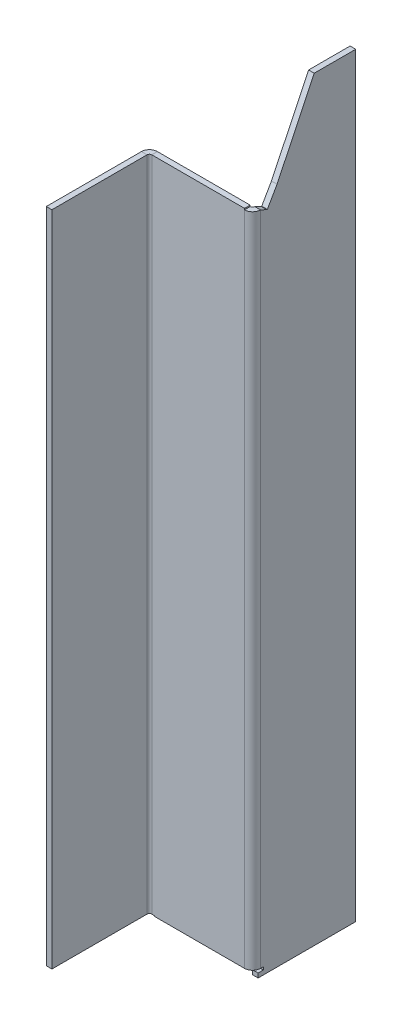
from build123d import *

# Parameters (mm, degrees)
BASE_FLANGE1_DEPTH            = 1.7366
EDGE_FLANGE1_START            = -115.730831119
EDGE_FLANGE1_DEPTH            = 204.671095583
EDGE_FLANGE1_2_DEPTH          = 0.8683
EDGE_FLANGE1_START_2          = 88.594139894
EDGE_FLANGE1_3_DEPTH          = 0.34612457
EDGE_FLANGE1_START_3          = -114.862531119
EDGE_FLANGE1_4_DEPTH          = 203.456671013
EDGE_FLANGE1_5_OUTLINE_W      = 29.4634
EDGE_FLANGE1_5_OUTLINE_H      = 1.7366
EDGE_FLANGE1_5_DEPTH          = 0.405860106
EDGE_FLANGE2_STRIP_W          = 8.4196
EDGE_FLANGE2_STRIP_H          = 1.7366
EDGE_FLANGE2_STRIP_CUT_DEPTH  = 203.662531119
EDGE_FLANGE2_RELIEF_W         = 9.2879
EDGE_FLANGE2_RELIEF_H         = 0.8683
EDGE_FLANGE2_RELIEF_CUT_DEPTH = 1.7366
EDGE_FLANGE2_DEPTH            = 203.662531119


# Read off the part's stored shape, not the designer's step: Edge-Flange1
# Sheet-metal steps are written as plain solids
with BuildPart() as part:
    # Sketch1 → Base-Flange1 (new body)
    with BuildSketch(Plane(origin=(0, 0, 0), x_dir=(0, 0, -1), z_dir=(1, 0, 0))):
        Polygon((2.253419205, 116.937468881), (-9.259888049, 92.904226435), (-12.275167803, 87.656070952), (-12.429418016, 87.67778326), (-15.116149142, 88.940264464), (-15.116149142, -117.062531119), (15.1, -117.062531119), (15.1, 116.937468881), align=None)
    extrude(amount=-BASE_FLANGE1_DEPTH)

    # Edge-Flange1 outline → Edge-Flange1 (cut)
    with BuildSketch(Plane(origin=(0, 0, 0), x_dir=(1, 0, 0), z_dir=(0, 1, 0)).offset(EDGE_FLANGE1_START)):
        with BuildLine():
            Line((0, -15.116149142), (0, -14.379549142))
            ThreePointArc((0, -14.379549142), (-0.02822066, -14.752100167), (-0.112238611, -15.116149142))
            Line((-0.112238611, -15.116149142), (0, -15.116149142))
        make_face()
    extrude(amount=EDGE_FLANGE1_DEPTH, mode=Mode.SUBTRACT)

    # Edge-Flange1 2 outline → Edge-Flange1 2 (cut)
    with BuildSketch(Plane(origin=(0, 0, 0), x_dir=(1, 0, 0), z_dir=(0, 1, 0)).offset(EDGE_FLANGE1_START)):
        with BuildLine():
            Line((0, -13.511249142), (-1.7366, -13.511249142))
            Line((-1.7366, -13.511249142), (-1.7366, -15.116149142))
            Line((-1.7366, -15.116149142), (-0.112238611, -15.116149142))
            ThreePointArc((-0.112238611, -15.116149142), (-0.02822066, -14.752100167), (0, -14.379549142))
            Line((0, -14.379549142), (0, -13.511249142))
        make_face()
    extrude(amount=EDGE_FLANGE1_2_DEPTH, mode=Mode.SUBTRACT)

    # Edge-Flange1 3 outline → Edge-Flange1 3 (cut)
    with BuildSketch(Plane(origin=(0, 0, 0), x_dir=(1, 0, 0), z_dir=(0, 1, 0)).offset(EDGE_FLANGE1_START_2)):
        with BuildLine():
            Line((0, -13.511249142), (-1.7366, -13.511249142))
            Line((-1.7366, -13.511249142), (-1.7366, -15.116149142))
            Line((-1.7366, -15.116149142), (-0.112238611, -15.116149142))
            ThreePointArc((-0.112238611, -15.116149142), (-0.02822066, -14.752100167), (0, -14.379549142))
            Line((0, -14.379549142), (0, -13.511249142))
        make_face()
    extrude(amount=EDGE_FLANGE1_3_DEPTH, mode=Mode.SUBTRACT)

    # Edge-Flange1 4 outline → Edge-Flange1 4 (add)
    with BuildSketch(Plane(origin=(0, 0, 0), x_dir=(1, 0, 0), z_dir=(0, 1, 0)).offset(EDGE_FLANGE1_START_3)):
        with BuildLine():
            Line((-1.7366, -15.116149142), (-1.7366, -14.379549142))
            ThreePointArc((-1.7366, -14.379549142), (-1.952345145, -14.900403997), (-2.4732, -15.116149142))
            Line((-2.4732, -15.116149142), (-31.9366, -15.116149142))
            Line((-31.9366, -15.116149142), (-31.9366, -16.852749142))
            Line((-31.9366, -16.852749142), (-2.4732, -16.852749142))
            ThreePointArc((-2.4732, -16.852749142), (-1.007771885, -16.371843969), (-0.112238611, -15.116149142))
            Line((-0.112238611, -15.116149142), (-1.7366, -15.116149142))
        make_face()
    extrude(amount=EDGE_FLANGE1_4_DEPTH)

    # Edge-Flange1 5 outline → Edge-Flange1 5 (add)
    with BuildSketch(Plane(origin=(0, 0, 0), x_dir=(1, 0, 0), z_dir=(0, 1, 0)).offset(EDGE_FLANGE1_START_2)):
        with Locations((-17.2049, -15.984449142)):
            Rectangle(EDGE_FLANGE1_5_OUTLINE_W, EDGE_FLANGE1_5_OUTLINE_H)
    extrude(amount=EDGE_FLANGE1_5_DEPTH)

    # Edge-Flange2 strip (across the edge) → Edge-Flange2 strip cut (cut)
    with BuildSketch(Plane(origin=(-31.9366, 89, 16.852749142), x_dir=(1, 0, 0), z_dir=(0, -1, 0))):
        with Locations((-3.4732, -0.8683)):
            Rectangle(EDGE_FLANGE2_STRIP_W, EDGE_FLANGE2_STRIP_H)
    extrude(amount=EDGE_FLANGE2_STRIP_CUT_DEPTH, mode=Mode.SUBTRACT)

    # Edge-Flange2 relief (on the sheet) → Edge-Flange2 relief cut (cut)
    with BuildSketch(Plane(origin=(-31.2, 89, 16.852749142), x_dir=(1, 0, 0), z_dir=(0, 0, 1))):
        with Locations((-3.77565, -204.096681119)):
            Rectangle(EDGE_FLANGE2_RELIEF_W, EDGE_FLANGE2_RELIEF_H)
    extrude(amount=-EDGE_FLANGE2_RELIEF_CUT_DEPTH, mode=Mode.SUBTRACT)

    # Edge-Flange2 section (across the edge) → Edge-Flange2 (add)
    with BuildSketch(Plane(origin=(-31.9366, 89, 16.852749142), x_dir=(1, 0, 0), z_dir=(0, -1, 0))):
        with BuildLine():
            Line((-1.7366, 0.7366), (-1.7366, 30.2))
            Line((-1.7366, 30.2), (0, 30.2))
            Line((0, 30.2), (0, 0.7366))
            ThreePointArc((0, 0.7366), (0.215745145, 0.215745145), (0.7366, 0))
            Line((0.7366, 0), (0.7366, -1.7366))
            ThreePointArc((0.7366, -1.7366), (-1.012216491, -1.012216491), (-1.7366, 0.7366))
        make_face()
    extrude(amount=EDGE_FLANGE2_DEPTH)


solid = part.part
